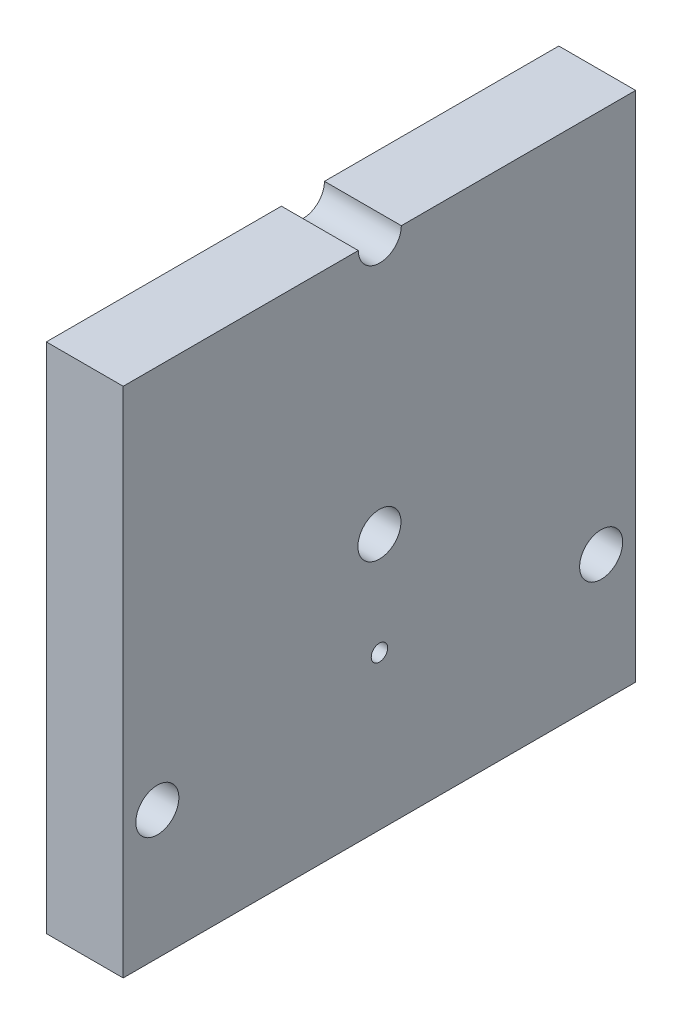
from build123d import *

# Parameters (mm, degrees)
SKETCH2_W           = 100
SKETCH2_H           = 100
SKETCH2_R           = 4.2
BOSS_EXTRUDE1_DEPTH = 15
SKETCH3_R           = 4.2
CUT_EXTRUDE1_DEPTH  = 73.284161474
SKETCH4_R           = 1.6
CUT_EXTRUDE2_DEPTH  = 73.284161474


with BuildPart() as part:
    # Sketch2 → Boss-Extrude1 (new body)
    with BuildSketch(Plane(origin=(0, 0, 0), x_dir=(0, 0, -1), z_dir=(1, 0, 0))):
        Rectangle(SKETCH2_W, SKETCH2_H)
        Circle(SKETCH2_R, mode=Mode.SUBTRACT)
    extrude(amount=BOSS_EXTRUDE1_DEPTH)

    # Sketch3 → Cut-Extrude1 (cut, through all)
    with BuildSketch(Plane.ZY):
        with Locations((43.336976945, -24.938051834)):
            Circle(SKETCH3_R)
        with Locations((-43.265474881, -25.061897041)):
            Circle(SKETCH3_R)
        with Locations((-0.071502064, 49.999948875)):
            Circle(SKETCH3_R)
    extrude(amount=-CUT_EXTRUDE1_DEPTH, mode=Mode.SUBTRACT)

    # Sketch4 → Cut-Extrude2 (cut, through all)
    with BuildSketch(Plane.ZY):
        with Locations((0, -20)):
            Circle(SKETCH4_R)
    extrude(amount=-CUT_EXTRUDE2_DEPTH, mode=Mode.SUBTRACT)


solid = part.part
